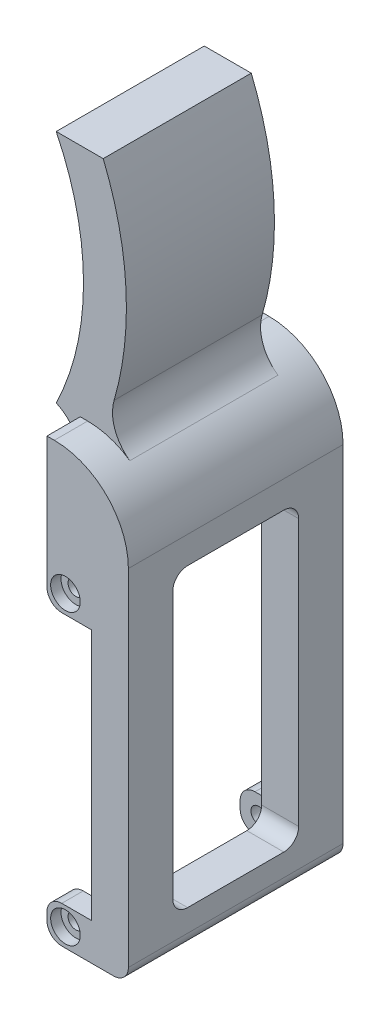
from build123d import *

# Parameters (mm, degrees)
BOSS_EXTRUDE5_DEPTH = 10
BOSS_EXTRUDE6_DEPTH = 14.5
BOSS_EXTRUDE7_REACH = 63.425
SKETCH28_W          = 11
SKETCH28_H          = 29
SKETCH37_W          = 23.2
SKETCH37_H          = 14.666666667
CUT_EXTRUDE10_DEPTH = 6
SKETCH38_W          = 23.2
SKETCH38_H          = 5
CUT_EXTRUDE11_DEPTH = 6
SKETCH39_R          = 1.05
CUT_EXTRUDE12_DEPTH = 81.736980805
SKETCH40_R          = 2
CUT_EXTRUDE13_DEPTH = 1.4
SKETCH41_R          = 2
CUT_EXTRUDE14_DEPTH = 1.4
SKETCH42_W          = 17
SKETCH42_H          = 40
CUT_EXTRUDE15_DEPTH = 77.175521458
FILLET2_R           = 2
CUT_EXTRUDE16_DEPTH = 80.232001549
BOSS_EXTRUDE8_DEPTH = 10
FILLET3_R           = 10
FILLET4_R           = 5.45


with BuildPart() as part:
    # Sketch25 → Boss-Extrude5 (new, symmetric)
    with BuildSketch(Plane.XY):
        with BuildLine():
            Line((0, 15.875), (6.35, 15.875))
            ThreePointArc((6.35, 15.875), (9.840958299, 0), (6.35, -15.875))
            Line((6.35, -15.875), (0, -15.875))
            ThreePointArc((0, -15.875), (4.187196601, 0), (0, 15.875))
        make_face()
    extrude(amount=BOSS_EXTRUDE5_DEPTH, both=True)


with BuildPart() as body_2:
    # Sketch27 → Boss-Extrude6 (new, symmetric)
    with BuildSketch(Plane.XY):
        Polygon((0, -30.541666667), (11, -30.541666667), (11, -74.541666667), (0, -74.541666667), (0, -69.541666667), (6, -69.541666667), (6, -35.541666667), (0, -35.541666667), align=None)
    extrude(amount=BOSS_EXTRUDE6_DEPTH, both=True)

    # Sketch28 → Boss-Extrude7 (add, up to next)
    with BuildSketch(Plane.XZ.offset(15.875), mode=Mode.PRIVATE) as boss_extrude7_sk1:
        with Locations((5.5, 0)):
            Rectangle(SKETCH28_W, SKETCH28_H)
    boss_extrude7_tool1 = extrude(boss_extrude7_sk1.sketch, amount=BOSS_EXTRUDE7_REACH, mode=Mode.PRIVATE) - body_2.part

    add(part.part)  # Boss-Extrude7 merges part
    add(boss_extrude7_tool1.solids().sort_by_distance((5.5, -15.875, 0))[0])

    # Sketch37 → Cut-Extrude10 (cut)
    with BuildSketch(Plane.ZY):
        with Locations((0, -28.208333334)):
            Rectangle(SKETCH37_W, SKETCH37_H)
    extrude(amount=-CUT_EXTRUDE10_DEPTH, mode=Mode.SUBTRACT)

    # Sketch38 → Cut-Extrude11 (cut)
    with BuildSketch(Plane.ZY):
        with Locations((0, -72.041666667)):
            Rectangle(SKETCH38_W, SKETCH38_H)
    extrude(amount=-CUT_EXTRUDE11_DEPTH, mode=Mode.SUBTRACT)

    # Sketch39 → Cut-Extrude12 (cut, through all)
    with BuildSketch(Plane(origin=(0, 0, -14.5), x_dir=(-1, 0, 0), z_dir=(0, 0, -1))):
        with Locations((-2.5, -33.041666667)):
            Circle(SKETCH39_R)
        with Locations((-2.5, -72.041666667)):
            Circle(SKETCH39_R)
    extrude(amount=-CUT_EXTRUDE12_DEPTH, mode=Mode.SUBTRACT)

    # Sketch40 → Cut-Extrude13 (cut)
    with BuildSketch(Plane(origin=(0, 0, -14.5), x_dir=(-1, 0, 0), z_dir=(0, 0, -1))):
        with Locations((-2.5, -33.041666667)):
            Circle(SKETCH40_R)
        with Locations((-2.5, -72.041666667)):
            Circle(SKETCH40_R)
    extrude(amount=-CUT_EXTRUDE13_DEPTH, mode=Mode.SUBTRACT)

    # Sketch41 → Cut-Extrude14 (cut)
    with BuildSketch(Plane.XY.offset(14.5)):
        with Locations(Location((2.5, -33.041666667, 0), (0, 0, 180))):
            Circle(SKETCH41_R)
        with Locations(Location((2.5, -72.041666667, 0), (0, 0, 180))):
            Circle(SKETCH41_R)
    extrude(amount=-CUT_EXTRUDE14_DEPTH, mode=Mode.SUBTRACT)

    # Sketch42 → Cut-Extrude15 (cut, through all)
    with BuildSketch(Plane.ZY.offset(-6)):
        with Locations((0, -49.541666667)):
            Rectangle(SKETCH42_W, SKETCH42_H)
    extrude(amount=-CUT_EXTRUDE15_DEPTH, mode=Mode.SUBTRACT)

    # Fillet2
    fillet2_edges = [body_2.edges().sort_by_distance(p)[0] for p in [
        (8.5, -69.541666667, -8.5),
        (8.5, -29.541666667, -8.5),
        (8.5, -29.541666667, 8.5),
        (8.5, -69.541666667, 8.5),
        (0, -35.541666667, 13.05),
        (0, -69.541666667, 13.05),
        (0, -74.541666667, 13.05),
        (11, -74.541666667, 0),
        (0, -35.541666667, -13.05),
        (0, -74.541666667, -13.05),
        (0, -69.541666667, -13.05),
    ]]
    fillet(fillet2_edges, radius=FILLET2_R)

    # Sketch44 → Cut-Extrude16 (cut, through all)
    with BuildSketch(Plane.XY.offset(10)):
        with BuildLine():
            Line((6.35, -15.875), (0, -15.875))
            ThreePointArc((0, -15.875), (4.187196601, 0), (0, 15.875))
            Line((0, 15.875), (6.35, 15.875))
            ThreePointArc((6.35, 15.875), (9.840958299, 0), (6.35, -15.875))
        make_face()
    extrude(amount=-CUT_EXTRUDE16_DEPTH, mode=Mode.SUBTRACT)

    # Sketch43 → Boss-Extrude8 (add, symmetric)
    with BuildSketch(Plane.XY):
        with BuildLine():
            Line((-3.25, 15.875), (3.1, 15.875))
            ThreePointArc((3.1, 15.875), (6.232422098, 0), (3.1, -15.875))
            Line((3.1, -15.875), (-3.25, -15.875))
            ThreePointArc((-3.25, -15.875), (0.439252949, 0), (-3.25, 15.875))
        make_face()
    extrude(amount=BOSS_EXTRUDE8_DEPTH, both=True)

    # Fillet3
    # the kernel refuses this fillet: 10 mm, written as the material it takes off along each edge
    with BuildSketch(Plane(origin=(11, -15.875, 39.5), x_dir=(-1, 0, 0), z_dir=(0, 0, -1))) as fillet3_piece_1_section:
        with BuildLine():
            CenterArc((FILLET3_R, -FILLET3_R), FILLET3_R, 90, 90)
            Line((0, -FILLET3_R), (0, 0))
            Line((0, 0), (FILLET3_R, 0))
        make_face()
    fillet3_piece_1 = extrude(amount=79, mode=Mode.PRIVATE)
    fillet3_piece_1 = split(fillet3_piece_1, bisect_by=Plane(origin=(2.190951885, -15.815672455, 10), z_dir=(0, 0, 1)), keep=Keep.TOP, mode=Mode.PRIVATE)
    fillet3_piece_1 = fillet3_piece_1 & Plane(origin=(-35.560747051, 0, 24.75), x_dir=(0.925049424055658, 0.3798467625955178, 0), z_dir=(0, 0, 1)) * Cylinder(41.793169149, 198, mode=Mode.PRIVATE)
    add(fillet3_piece_1, mode=Mode.SUBTRACT)
    with BuildSketch(Plane(origin=(11, -15.875, 39.5), x_dir=(-1, 0, 0), z_dir=(0, 0, -1))) as fillet3_piece_2_section:
        with BuildLine():
            CenterArc((FILLET3_R, -FILLET3_R), FILLET3_R, 90, 90)
            Line((0, -FILLET3_R), (0, 0))
            Line((0, 0), (FILLET3_R, 0))
        make_face()
    fillet3_piece_2 = extrude(amount=79, mode=Mode.PRIVATE)
    fillet3_piece_2 = split(fillet3_piece_2, bisect_by=Plane(origin=(8.886802667, -18.192463431, 10), z_dir=(0, 0, 1)), keep=Keep.TOP, mode=Mode.PRIVATE)
    fillet3_piece_2 = fillet3_piece_2 - Plane(origin=(-35.560747051, 0, 24.75), x_dir=(0.925049424055658, 0.3798467625955178, 0), z_dir=(0, 0, 1)) * Cylinder(41.793169149, 198, mode=Mode.PRIVATE)
    add(fillet3_piece_2, mode=Mode.SUBTRACT)
    with BuildSketch(Plane(origin=(11, -15.875, 39.5), x_dir=(-1, 0, 0), z_dir=(0, 0, -1))) as fillet3_piece_3_section:
        with BuildLine():
            CenterArc((FILLET3_R, -FILLET3_R), FILLET3_R, 90, 90)
            Line((0, -FILLET3_R), (0, 0))
            Line((0, 0), (FILLET3_R, 0))
        make_face()
    fillet3_piece_3 = extrude(amount=79, mode=Mode.PRIVATE)
    fillet3_piece_3 = split(fillet3_piece_3, bisect_by=Plane(origin=(8.886802667, -18.192463431, 10), z_dir=(0, 0, -1)), keep=Keep.TOP, mode=Mode.PRIVATE)
    fillet3_piece_3 = fillet3_piece_3 - Plane(origin=(-35.560747051, 0, 0), x_dir=(0.925049424055658, 0.3798467625955178, 0), z_dir=(0, 0, 1)) * Cylinder(41.793169149, 198, mode=Mode.PRIVATE)
    fillet3_piece_3 = split(fillet3_piece_3, bisect_by=Plane(origin=(8.886802667, -18.192463431, -10), z_dir=(0, 0, 1)), keep=Keep.TOP, mode=Mode.PRIVATE)
    add(fillet3_piece_3, mode=Mode.SUBTRACT)
    with BuildSketch(Plane(origin=(11, -15.875, 39.5), x_dir=(-1, 0, 0), z_dir=(0, 0, -1))) as fillet3_piece_4_section:
        with BuildLine():
            CenterArc((FILLET3_R, -FILLET3_R), FILLET3_R, 90, 90)
            Line((0, -FILLET3_R), (0, 0))
            Line((0, 0), (FILLET3_R, 0))
        make_face()
    fillet3_piece_4 = extrude(amount=79, mode=Mode.PRIVATE)
    fillet3_piece_4 = fillet3_piece_4 & Plane(origin=(-35.560747051, 0, -24.75), x_dir=(0.925049424055658, 0.3798467625955178, 0), z_dir=(0, 0, 1)) * Cylinder(41.793169149, 198, mode=Mode.PRIVATE)
    fillet3_piece_4 = split(fillet3_piece_4, bisect_by=Plane(origin=(2.190951885, -15.815672455, -10), z_dir=(0, 0, -1)), keep=Keep.TOP, mode=Mode.PRIVATE)
    add(fillet3_piece_4, mode=Mode.SUBTRACT)
    with BuildSketch(Plane(origin=(11, -15.875, 39.5), x_dir=(-1, 0, 0), z_dir=(0, 0, -1))) as fillet3_piece_5_section:
        with BuildLine():
            CenterArc((FILLET3_R, -FILLET3_R), FILLET3_R, 90, 90)
            Line((0, -FILLET3_R), (0, 0))
            Line((0, 0), (FILLET3_R, 0))
        make_face()
    fillet3_piece_5 = extrude(amount=79, mode=Mode.PRIVATE)
    fillet3_piece_5 = fillet3_piece_5 - Plane(origin=(-35.560747051, 0, -24.75), x_dir=(0.925049424055658, 0.3798467625955178, 0), z_dir=(0, 0, 1)) * Cylinder(41.793169149, 198, mode=Mode.PRIVATE)
    fillet3_piece_5 = split(fillet3_piece_5, bisect_by=Plane(origin=(8.886802667, -18.192463431, -10), z_dir=(0, 0, -1)), keep=Keep.TOP, mode=Mode.PRIVATE)
    add(fillet3_piece_5, mode=Mode.SUBTRACT)

    # Fillet4
    # the kernel refuses this fillet: 5.45 mm, written as the material it adds along each edge
    with BuildSketch(Plane(origin=(0, -15.875, 10), x_dir=(-1, 0, 0), z_dir=(0, 0, -1))) as fillet4_piece_1:
        with BuildLine():
            CenterArc((5.45, -4.986231042), FILLET4_R, 113.807792078, 66.192207922)
            Line((0, -4.986231042), (0, 0))
            Line((0, 0), (3.25, 0))
        make_face()
    extrude(amount=20)
    with BuildSketch(Plane(origin=(3.015126937, -16.080140969, -10), x_dir=(0.33239794280209367, 0.9431392302417156, 0), z_dir=(0, 0, 1))) as fillet4_piece_2:
        with BuildLine():
            CenterArc((4.992113304, -5.441426809), FILLET4_R, 93.214160673, 71.449916977)
            ThreePointArc((-0.263821953, -4.000023125), (0.07058047, -2.013366907), (0, 0))
            ThreePointArc((0, 0), (2.343270621, -0.065743272), (4.686541241, 0))
        make_face()
    extrude(amount=20)


solid = body_2.part
